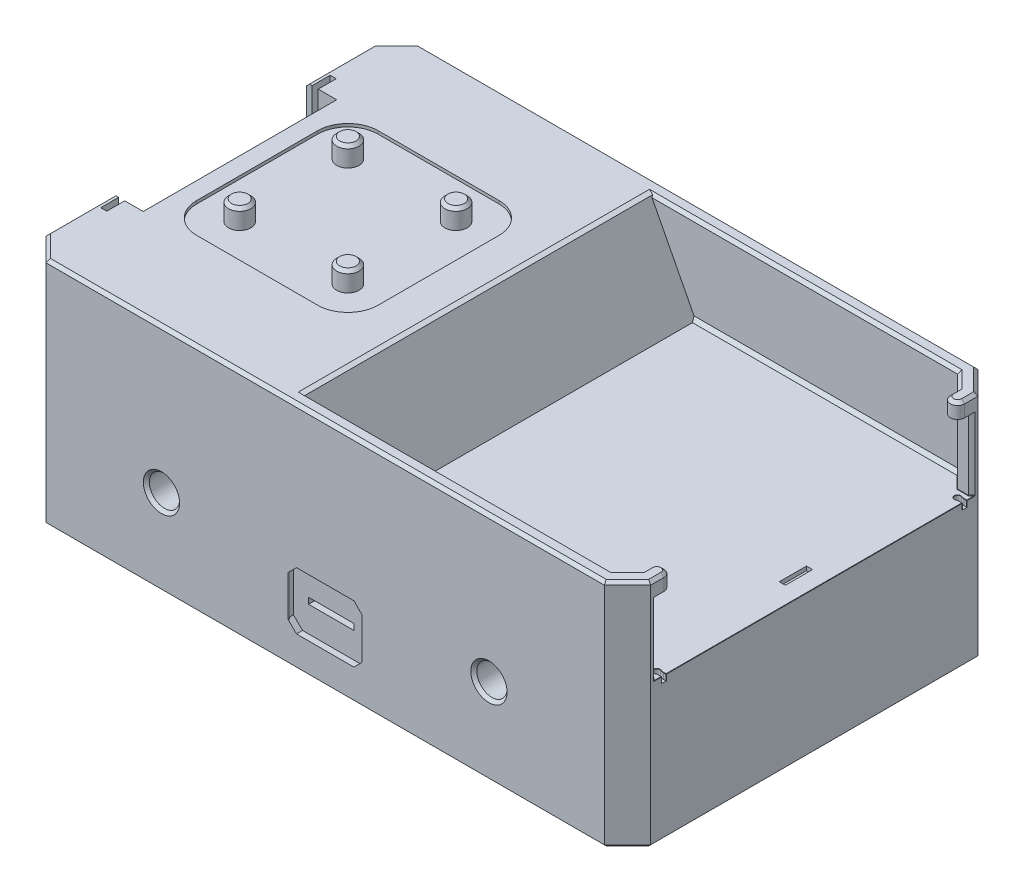
from build123d import *

# Parameters (mm, degrees)
EXTRUDE_1_DEPTH           = 76.3848
CUT_EXTRUDE_3_DEPTH       = 71.3848
CUT_EXTRUDE_4_DEPTH       = 20.3848
CUT_EXTRUDE_4_DEPTH_BACK  = 135
SKETCH_5_R                = 5
SKETCH_10_W               = 10
SKETCH_10_H               = 32
CUT_EXTRUDE_5_DEPTH       = 30
SKETCH_11_W               = 15
SKETCH_11_H               = 2
CUT_EXTRUDE_6_DEPTH       = 146
CUT_EXTRUDE_7_DEPTH       = 2
SKETCH_18_W               = 229.310359278
SKETCH_18_H               = 77.651202659
CUT_EXTRUDE_9_DEPTH       = 117.5
SKETCH_19_W               = 0.5
SKETCH_19_H               = 15
EXTRUDE_2_DEPTH           = 0.5
SKETCH_20_W               = 0.5
SKETCH_20_H               = 15
EXTRUDE_3_DEPTH           = 0.5
CHAMFER_2_SIZE            = 1
SKETCH_22_W               = 2
SKETCH_22_H               = 75.895289502
CUT_EXTRUDE_10_DEPTH      = 34
EXTRUDE_4_DEPTH           = 31
CUT_EXTRUDE_11_DEPTH      = 29
CUT_EXTRUDE_19_DEPTH      = 114.2
EXTRUDE_6_DEPTH           = 114.6
CHAMFER_19_SIZE           = 1
CHAMFER_20_SIZE           = 2
CUT_EXTRUDE_20_DEPTH      = 114.2
SKETCH_35_W               = 104.2
SKETCH_35_H               = 29
CUT_EXTRUDE_21_DEPTH      = 114.2
CHAMFER_24_SIZE           = 1.312830984
CHAMFER_24_SIZE_2         = 0.562935
CHAMFER_26_SIZE           = 1
CHAMFER_3_SIZE            = 1
SKETCH_36_R               = 2.35
EXTRUDE_8_DEPTH           = 5
CUT_EXTRUDE_22_DEPTH      = 26
CUT_EXTRUDE_22_DEPTH_BACK = 2
SKETCH_37_R               = 1
CHAMFER_12_SIZE           = 1
CUT_EXTRUDE_23_DEPTH      = 2
CHAMFER_28_SIZE           = 0.1
CHAMFER_31_SIZE           = 1.1
CHAMFER_32_SIZE           = 1.1
CHAMFER_33_SIZE           = 0.1
SKETCH_50_W               = 2
SKETCH_50_H               = 9
CUT_EXTRUDE_24_DEPTH      = 1.5
SKETCH_52_W               = 1.344454814
SKETCH_52_H               = 8.419143546
EXTRUDE_9_DEPTH           = 0.5
SKETCH_56_R               = 10
EXTRUDE_10_DEPTH          = 115
SKETCH_57_R               = 5
CUT_EXTRUDE_25_DEPTH      = 135
SKETCH_58_R               = 3.698
EXTRUDE_11_DEPTH          = 5.5
CHAMFER_34_SIZE           = 1
CUT_EXTRUDE_START         = -1
CUT_EXTRUDE_27_DEPTH      = 1


with BuildPart() as part:
    # 草图2 → 凸台-拉伸1 (new body)
    with BuildSketch(Plane(origin=(0, 0, 0), x_dir=(1, 0, 0), z_dir=(0, 1, 0))):
        Polygon((92.36152, 61.8), (100, 54.16152), (100, -54.16152), (92.36152, -61.8), (-92.36152, -61.8), (-100, -54.16152), (-100, 54.16152), (-92.36152, 61.8), align=None)
    extrude(amount=EXTRUDE_1_DEPTH)

    # 草图6 → 切除-拉伸3 (cut)
    with BuildSketch(Plane.XZ):
        Polygon((88.042068976, -56.8), (94.222068976, -50.62), (94.222068976, 50.62), (88.042068976, 56.8), (-88.042068976, 56.8), (-94.222068976, 50.62), (-94.222068976, -50.62), (-88.042068976, -56.8), align=None)
    extrude(amount=-CUT_EXTRUDE_3_DEPTH, mode=Mode.SUBTRACT)

    # 草图5 → 切除-拉伸4 (cut, two sides: drawn at the far end of the back side and taken through both)
    with BuildSketch(Plane.XY.offset(61.8).offset(-CUT_EXTRUDE_4_DEPTH_BACK)):
        with Locations(Location((-54.16912, 28.6443, 0), (0, 0, 180))):
            Circle(SKETCH_5_R)
        with Locations(Location((54.16912, 28.6443, 0), (0, 0, 180))):
            Circle(SKETCH_5_R)
    extrude(amount=CUT_EXTRUDE_4_DEPTH + CUT_EXTRUDE_4_DEPTH_BACK, mode=Mode.SUBTRACT)

    # 草图10 → 切除-拉伸5 (cut)
    with BuildSketch(Plane(origin=(0, 76.3848, 0), x_dir=(1, 0, 0), z_dir=(0, 1, 0))):
        Polygon((-100, -32), (-100, 0), (-100, 32), (-110, 32), (-110, -32), align=None)
        with Locations((-95, -16)):
            Rectangle(SKETCH_10_W, SKETCH_10_H)
        with Locations((-95, 16)):
            Rectangle(SKETCH_10_W, SKETCH_10_H)
    extrude(amount=-CUT_EXTRUDE_5_DEPTH, mode=Mode.SUBTRACT)

    # 草图11 → 切除-拉伸6 (cut)
    with BuildSketch(Plane.XY.offset(61.8)):
        with Locations((0, 20)):
            Rectangle(SKETCH_11_W, SKETCH_11_H)
    extrude(amount=-CUT_EXTRUDE_6_DEPTH, mode=Mode.SUBTRACT)

    # 草图12 → 切除-拉伸7 (cut)
    with BuildSketch(Plane.XY.offset(61.8)):
        Polygon((-9.5, 10.5), (-12.5, 13.5), (-12.5, 26.5), (-9.5, 29.5), (9.5, 29.5), (12.5, 26.5), (12.5, 13.5), (9.5, 10.5), align=None)
    extrude(amount=-CUT_EXTRUDE_7_DEPTH, mode=Mode.SUBTRACT)

    # 草图18 → 切除-拉伸9 (cut)
    with BuildSketch(Plane(origin=(0, 76.3848, 0), x_dir=(1, 0, 0), z_dir=(0, 1, 0))):
        with Locations((-2.928886209, 38.82560133)):
            Rectangle(SKETCH_18_W, SKETCH_18_H)
    extrude(amount=-CUT_EXTRUDE_9_DEPTH, mode=Mode.SUBTRACT)

    # 镜向1: part across plane


with BuildPart() as part_1:
    add(part.part)
    add(part.part.mirror(Plane(origin=(-117.584065848, -41.1152, 0), x_dir=(1, 0, 0), z_dir=(0, 0, 1))))

    # 草图19 → 凸台-拉伸2 (add)
    with BuildSketch(Plane(origin=(0, 0, -61.8), x_dir=(-1, 0, 0), z_dir=(0, 0, -1))):
        with Locations((-12.5, 20)):
            Rectangle(SKETCH_19_W, SKETCH_19_H)
        with Locations((12.498440545, 20)):
            Rectangle(SKETCH_19_W, SKETCH_19_H)
    extrude(amount=-EXTRUDE_2_DEPTH)

    # 草图20 → 凸台-拉伸3 (add)
    with BuildSketch(Plane.XY.offset(61.8)):
        with Locations((-12.498440545, 20.147073053)):
            Rectangle(SKETCH_20_W, SKETCH_20_H)
        with Locations((12.5, 20.147073053)):
            Rectangle(SKETCH_20_W, SKETCH_20_H)
    extrude(amount=-EXTRUDE_3_DEPTH)

    # 倒角2
    chamfer_2_edges = [part_1.edges().sort_by_distance(p)[0] for p in [
        (-96.18076, 0, 57.98076),
        (94.222068976, 0, 0),
        (-94.222068976, 0, 0),
        (-100, 0, 0),
        (0, 0, -56.8),
        (-96.18076, 0, -57.98076),
        (0, 0, -61.8),
        (96.18076, 0, -57.98076),
        (-91.132068976, 0, -53.71),
        (91.132068976, 0, -53.71),
        (-91.132068976, 0, 53.71),
        (0, 0, 56.8),
        (91.132068976, 0, 53.71),
        (100, 0, 0),
        (96.18076, 0, 57.98076),
        (0, 0, 61.8),
    ]]
    chamfer(chamfer_2_edges, length=CHAMFER_2_SIZE)

    # 草图22 → 切除-拉伸10 (cut)
    with BuildSketch(Plane(origin=(0, 76.3848, 0), x_dir=(1, 0, 0), z_dir=(0, 1, 0))):
        with Locations((-97.111034488, 0)):
            Rectangle(SKETCH_22_W, SKETCH_22_H)
    extrude(amount=-CUT_EXTRUDE_10_DEPTH, mode=Mode.SUBTRACT)

    # 草图25 → 凸台-拉伸4 (add)
    with BuildSketch(Plane(origin=(0, 76.3848, 0), x_dir=(1, 0, 0), z_dir=(0, 1, 0))):
        Polygon((0.707106781, 60.8), (91.947306438, 60.8), (99, 53.747306438), (99, -53.747306438), (91.947306438, -60.8), (0.707106781, -60.8), align=None)
    extrude(amount=-EXTRUDE_4_DEPTH)

    # 草图26 → 切除-拉伸11 (cut)
    with BuildSketch(Plane(origin=(0, 76.3848, 0), x_dir=(1, 0, 0), z_dir=(0, 1, 0))):
        Polygon((3.7, 57.1), (90.3, 57.1), (95.3, 52.1), (95.3, -52.1), (90.3, -57.1), (3.7, -57.1), align=None)
    extrude(amount=-CUT_EXTRUDE_11_DEPTH, mode=Mode.SUBTRACT)

    # 草图32 → 切除-拉伸19 (cut)
    with BuildSketch(Plane.XY.offset(-57.1)):
        Polygon((3.7, 76.3848), (-11.3, 76.3848), (3.7, 47.3848), align=None)
    extrude(amount=CUT_EXTRUDE_19_DEPTH, mode=Mode.SUBTRACT)

    # 草图33 → 凸台-拉伸6 (add)
    with BuildSketch(Plane.XY.offset(-57.1)):
        Polygon((3.7, 47.3848), (-11.3, 76.3848), (-15.741088216, 74.087685406), (-0.741088216, 45.087685406), align=None)
    extrude(amount=EXTRUDE_6_DEPTH)

    # 倒角19
    # the kernel refuses this chamfer: 1 mm, written as the material it takes off along each edge
    with BuildSketch(Plane(origin=(0.707106781, 45.3848, 56.8), x_dir=(-0.027495876610586306, 0.9996219169112968, 0), z_dir=(0, 0, -1))) as chamfer_19_piece_1_section:
        Polygon((CHAMFER_19_SIZE * 0.999621916911, CHAMFER_19_SIZE * 0.0274958766106), (-CHAMFER_19_SIZE * 0.0274958766106, CHAMFER_19_SIZE * 0.999621916911), (0, 0), align=None)
    chamfer_19_piece_1 = extrude(amount=113.6, mode=Mode.PRIVATE)
    chamfer_19_piece_1 = split(chamfer_19_piece_1, bisect_by=Plane(origin=(0.924503969, 45.949198604, 0), z_dir=(0.4594229188737669, -0.8882176431559488, 0)), keep=Keep.TOP, mode=Mode.PRIVATE)
    add(chamfer_19_piece_1, mode=Mode.SUBTRACT)

    # 倒角20
    chamfer_20_edges = [part_1.edges().sort_by_distance(p)[0] for p in [
        (-0.741088216, 45.087685406, 0),
    ]]
    chamfer(chamfer_20_edges, length=CHAMFER_20_SIZE)

    # 草图34 → 切除-拉伸20 (cut)
    with BuildSketch(Plane.XY.offset(-56.8)):
        Polygon((-1.659934054, 46.864120692), (0.07163221, 46.31316779), (4.534133906, 44.893280887), (0.600613433, 43.316920551), align=None)
    extrude(amount=CUT_EXTRUDE_20_DEPTH, mode=Mode.SUBTRACT)

    # 草图35 → 切除-拉伸21 (cut)
    with BuildSketch(Plane.ZY.offset(-95.3)):
        with Locations((0, 61.8848)):
            Rectangle(SKETCH_35_W, SKETCH_35_H)
    extrude(amount=-CUT_EXTRUDE_21_DEPTH, mode=Mode.SUBTRACT)

    # 倒角24
    # the kernel refuses this chamfer: 1.312830984, 0.562935 mm, written as the material it takes off along each edge
    with BuildSketch(Plane(origin=(-11.3, 76.3848, -57.1), x_dir=(-0.9999317627098931, 0.011682034235790593, 0), z_dir=(0, 0, 1))) as chamfer_24_piece_1:
        Polygon((CHAMFER_24_SIZE * 0.999931763041, CHAMFER_24_SIZE * 0.0116820342397), (-CHAMFER_24_SIZE_2 * 0.469767758015, CHAMFER_24_SIZE_2 * 0.882790039324), (0, 0), align=None)
    extrude(amount=114.2, mode=Mode.SUBTRACT)

    # 倒角26
    chamfer_26_edges = [part_1.edges().sort_by_distance(p)[0] for p in [
        (59.16912, 28.6443, -61.8),
        (-49.16912, 28.6443, -61.8),
    ]]
    chamfer(chamfer_26_edges, length=CHAMFER_26_SIZE)

    # 倒角3
    chamfer_3_edges = [part_1.edges().sort_by_distance(p)[0] for p in [
        (-49.16912, 28.6443, 61.8),
        (59.16912, 28.6443, 61.8),
    ]]
    chamfer(chamfer_3_edges, length=CHAMFER_3_SIZE)

    # 草图36 → 凸台-拉伸8 (add)
    with BuildSketch(Plane(origin=(0, 76.3848, 0), x_dir=(1, 0, 0), z_dir=(0, 1, 0))):
        with Locations((97.65, -49.75)):
            Circle(SKETCH_36_R)
        with BuildLine():
            ThreePointArc((97.65, -52.1), (95.988299064, -51.411700936), (95.3, -49.75))
            Line((95.3, -49.75), (95.3, -52.1))
            Line((95.3, -52.1), (97.65, -52.1))
        make_face()
        with BuildLine():
            Line((100, -52.1), (100, -49.75))
            ThreePointArc((100, -49.75), (99.311700936, -51.411700936), (97.65, -52.1))
            Line((97.65, -52.1), (100, -52.1))
        make_face()
        with Locations((97.65, 49.75)):
            Circle(SKETCH_36_R)
        with BuildLine():
            Line((97.65, 52.1), (95.3, 52.1))
            Line((95.3, 52.1), (95.3, 49.75))
            ThreePointArc((95.3, 49.75), (95.988299064, 51.411700936), (97.65, 52.1))
        make_face()
        with BuildLine():
            Line((100, 52.1), (97.65, 52.1))
            ThreePointArc((97.65, 52.1), (99.311700936, 51.411700936), (100, 49.75))
            Line((100, 49.75), (100, 52.1))
        make_face()
    extrude(amount=-EXTRUDE_8_DEPTH)

    # 草图37 → 切除-拉伸22 (cut, two sides: drawn at the far end of the back side and taken through both)
    with BuildSketch(Plane.XZ.offset(-71.3848).offset(-CUT_EXTRUDE_22_DEPTH_BACK)):
        with Locations(Location((97.65, -49.75, 0), (0, 0, 90))):
            Circle(SKETCH_37_R)
        with Locations(Location((97.65, 49.75, 0), (0, 0, 90))):
            Circle(SKETCH_37_R)
    extrude(amount=CUT_EXTRUDE_22_DEPTH + CUT_EXTRUDE_22_DEPTH_BACK, mode=Mode.SUBTRACT)

    # 倒角12
    # the kernel refuses this chamfer: 1 mm, written as the material it takes off along each edge
    with BuildSketch(Plane(origin=(94.933202988, 76.3848, -61.8), x_dir=(0, 0.027495876610582105, 0.999621916911297), z_dir=(-1, 0, 0)), Plane(origin=(94.933202988, 76.3848, 61.8), x_dir=(0, -0.9996219169112968, 0.027495876610589196), z_dir=(-1, 0, 0))) as chamfer_12_piece_1:
        Polygon((CHAMFER_12_SIZE * 0.999621916911, -CHAMFER_12_SIZE * 0.0274958766106), (-CHAMFER_12_SIZE * 0.0274958766106, -CHAMFER_12_SIZE * 0.999621916911), (0, 0), align=None)
    extrude(amount=189.866405976, mode=Mode.SUBTRACT)
    with BuildSketch(Plane(origin=(-90.54306552, 76.3848, -63.61845448), x_dir=(0.7068394360706739, 0.027495876610582108, 0.7068394360706732), z_dir=(-0.7071067811865472, 0, 0.7071067811865479)), Plane(origin=(101.81845448, 76.3848, 52.34306552), x_dir=(0.019442520806010433, -0.999621916911297, 0.019442520806010416), z_dir=(-0.7071067811865472, 0, 0.7071067811865479)), Plane(origin=(101.81845448, 76.3848, -52.34306552), x_dir=(-0.7068394360706739, 0.027495876610582108, 0.7068394360706732), z_dir=(-0.7071067811865472, 0, -0.7071067811865479))) as chamfer_12_piece_2:
        Polygon((CHAMFER_12_SIZE * 0.999621916911, -CHAMFER_12_SIZE * 0.0274958766106), (-CHAMFER_12_SIZE * 0.0274958766106, -CHAMFER_12_SIZE * 0.999621916911), (0, 0), align=None)
    extrude(amount=15.945807988, mode=Mode.SUBTRACT)
    with BuildSketch(Plane(origin=(-100, 76.3848, -56.733202988), x_dir=(0.999621916911297, 0.027495876610582292, 0), z_dir=(0, 0, 1))) as chamfer_12_piece_3:
        Polygon((CHAMFER_12_SIZE * 0.999621916911, -CHAMFER_12_SIZE * 0.0274958766106), (-CHAMFER_12_SIZE * 0.0274958766106, -CHAMFER_12_SIZE * 0.999621916911), (0, 0), align=None)
    extrude(amount=27.304885976, mode=Mode.SUBTRACT)
    with BuildSketch(Plane(origin=(92.871682988, 76.3848, 57.1), x_dir=(0, 0.027495876610582105, 0.999621916911297), z_dir=(-1, 0, 0))) as chamfer_12_piece_4_section:
        Polygon((CHAMFER_12_SIZE * 0.999621916911, -CHAMFER_12_SIZE * 0.0274958766106), (-CHAMFER_12_SIZE * 0.0274958766106, -CHAMFER_12_SIZE * 0.999621916911), (0, 0), align=None)
    chamfer_12_piece_4 = extrude(amount=106.743365976, mode=Mode.PRIVATE)
    chamfer_12_piece_4 = split(chamfer_12_piece_4, bisect_by=Plane(origin=(34.78725673, 61.302953909, 57.429620247), z_dir=(0.30320365727720744, 0.9529257800131791, 0)), keep=Keep.TOP, mode=Mode.PRIVATE)
    chamfer_12_piece_4 = split(chamfer_12_piece_4, bisect_by=Plane(origin=(64.725819512, 76.055533328, 82.674180488), z_dir=(-0.7071067811865466, 0, -0.7071067811865486)), keep=Keep.TOP, mode=Mode.PRIVATE)
    chamfer_12_piece_4 = split(chamfer_12_piece_4, bisect_by=Plane(origin=(-0.447266099, 55.402847791, 57.429620247), z_dir=(0.8882176431559488, 0.4594229188737667, 0)), keep=Keep.TOP, mode=Mode.PRIVATE)
    add(chamfer_12_piece_4, mode=Mode.SUBTRACT)
    with BuildSketch(Plane(origin=(92.871682988, 76.3848, 57.1), x_dir=(0, 0.027495876610582105, 0.999621916911297), z_dir=(-1, 0, 0))) as chamfer_12_piece_5_section:
        Polygon((CHAMFER_12_SIZE * 0.999621916911, -CHAMFER_12_SIZE * 0.0274958766106), (-CHAMFER_12_SIZE * 0.0274958766106, -CHAMFER_12_SIZE * 0.999621916911), (0, 0), align=None)
    chamfer_12_piece_5 = extrude(amount=106.743365976, mode=Mode.PRIVATE)
    chamfer_12_piece_5 = split(chamfer_12_piece_5, bisect_by=Plane(origin=(-10.508845679, 75.71535013, 57.197754678), z_dir=(-0.30320365727720744, -0.9529257800131791, 0)), keep=Keep.TOP, mode=Mode.PRIVATE)
    chamfer_12_piece_5 = split(chamfer_12_piece_5, bisect_by=Plane(origin=(-10.824530531, 75.465559027, 57.197754678), z_dir=(0.8882176431559488, 0.4594229188737667, 0)), keep=Keep.TOP, mode=Mode.PRIVATE)
    add(chamfer_12_piece_5, mode=Mode.SUBTRACT)
    with BuildSketch(Plane(origin=(92.871682988, 76.3848, 57.1), x_dir=(0, 0.027495876610582105, 0.999621916911297), z_dir=(-1, 0, 0))) as chamfer_12_piece_6_section:
        Polygon((CHAMFER_12_SIZE * 0.999621916911, -CHAMFER_12_SIZE * 0.0274958766106), (-CHAMFER_12_SIZE * 0.0274958766106, -CHAMFER_12_SIZE * 0.999621916911), (0, 0), align=None)
    chamfer_12_piece_6 = extrude(amount=106.743365976, mode=Mode.PRIVATE)
    chamfer_12_piece_6 = split(chamfer_12_piece_6, bisect_by=Plane(origin=(-11.758522746, 76.112974651, 57.536386216), z_dir=(0.30320365727720744, 0.9529257800131791, 0)), keep=Keep.TOP, mode=Mode.PRIVATE)
    chamfer_12_piece_6 = split(chamfer_12_piece_6, bisect_by=Plane(origin=(-11.333395246, 76.449364142, 57.536386216), z_dir=(-0.8882176431559488, -0.4594229188737667, 0)), keep=Keep.TOP, mode=Mode.PRIVATE)
    add(chamfer_12_piece_6, mode=Mode.SUBTRACT)
    with BuildSketch(Plane(origin=(97.11845448, 76.3848, 50.28154552), x_dir=(0.7068394360706726, 0.027495876610582108, 0.7068394360706746), z_dir=(-0.7071067811865486, 0, 0.7071067811865466))) as chamfer_12_piece_7_section:
        Polygon((CHAMFER_12_SIZE * 0.999621916911, -CHAMFER_12_SIZE * 0.0274958766106), (-CHAMFER_12_SIZE * 0.0274958766106, -CHAMFER_12_SIZE * 0.999621916911), (0, 0), align=None)
    chamfer_12_piece_7 = extrude(amount=12.214433788, mode=Mode.PRIVATE)
    chamfer_12_piece_7 = split(chamfer_12_piece_7, bisect_by=Plane(origin=(93.019192224, 76.044416391, 57.1), z_dir=(0, 0, -1)), keep=Keep.TOP, mode=Mode.PRIVATE)
    chamfer_12_piece_7 = split(chamfer_12_piece_7, bisect_by=Plane(origin=(95.3, 76.044416391, 54.819192224), z_dir=(-1, 0, 0)), keep=Keep.TOP, mode=Mode.PRIVATE)
    add(chamfer_12_piece_7, mode=Mode.SUBTRACT)
    with BuildSketch(Plane(origin=(100, 76.3848, 56.733202988), x_dir=(-0.999621916911297, 0.027495876610582292, -3.2200878226457506e-15), z_dir=(0, 0, -1)), Plane(origin=(100, 76.3848, -49.75), x_dir=(-0.999621916911297, 0.027495876610582292, 3.2200878226457506e-15), z_dir=(0, 0, -1))) as chamfer_12_piece_8:
        Polygon((CHAMFER_12_SIZE * 0.999621916911, -CHAMFER_12_SIZE * 0.0274958766106), (-CHAMFER_12_SIZE * 0.0274958766106, -CHAMFER_12_SIZE * 0.999621916911), (0, 0), align=None)
    extrude(amount=6.983202988, mode=Mode.SUBTRACT)
    with BuildSketch(Plane(origin=(-100, 76.3848, 56.733202988), x_dir=(0.999621916911297, 0.027495876610582292, 0), z_dir=(0, 0, -1))) as chamfer_12_piece_9:
        Polygon((CHAMFER_12_SIZE * 0.999621916911, CHAMFER_12_SIZE * 0.0274958766106), (-CHAMFER_12_SIZE * 0.0274958766106, CHAMFER_12_SIZE * 0.999621916911), (0, 0), align=None)
    extrude(amount=27.304885976, mode=Mode.SUBTRACT)
    with BuildSketch(Plane(origin=(-90.54306552, 76.3848, 63.61845448), x_dir=(0.7068394360706739, 0.027495876610582108, -0.7068394360706732), z_dir=(-0.7071067811865472, 0, -0.7071067811865479))) as chamfer_12_piece_10:
        Polygon((CHAMFER_12_SIZE * 0.999621916911, CHAMFER_12_SIZE * 0.0274958766106), (-CHAMFER_12_SIZE * 0.0274958766106, CHAMFER_12_SIZE * 0.999621916911), (0, 0), align=None)
    extrude(amount=15.945807988, mode=Mode.SUBTRACT)
    with BuildSketch(Plane(origin=(-15.184513972, 76.3848, -57.1), x_dir=(0, 0.027495876610582105, -0.999621916911297), z_dir=(1, 0, 0))) as chamfer_12_piece_11_section:
        Polygon((CHAMFER_12_SIZE * 0.999621916911, -CHAMFER_12_SIZE * 0.0274958766106), (-CHAMFER_12_SIZE * 0.0274958766106, -CHAMFER_12_SIZE * 0.999621916911), (0, 0), align=None)
    chamfer_12_piece_11 = extrude(amount=108.05619696, mode=Mode.PRIVATE)
    chamfer_12_piece_11 = split(chamfer_12_piece_11, bisect_by=Plane(origin=(-10.508845679, 75.71535013, -57.197754678), z_dir=(-0.30320365727720744, -0.9529257800131791, 0)), keep=Keep.TOP, mode=Mode.PRIVATE)
    chamfer_12_piece_11 = split(chamfer_12_piece_11, bisect_by=Plane(origin=(-10.824530531, 75.465559027, -57.197754678), z_dir=(0.8882176431559488, 0.4594229188737667, 0)), keep=Keep.TOP, mode=Mode.PRIVATE)
    add(chamfer_12_piece_11, mode=Mode.SUBTRACT)
    with BuildSketch(Plane(origin=(-15.184513972, 76.3848, -57.1), x_dir=(0, 0.027495876610582105, -0.999621916911297), z_dir=(1, 0, 0))) as chamfer_12_piece_12_section:
        Polygon((CHAMFER_12_SIZE * 0.999621916911, -CHAMFER_12_SIZE * 0.0274958766106), (-CHAMFER_12_SIZE * 0.0274958766106, -CHAMFER_12_SIZE * 0.999621916911), (0, 0), align=None)
    chamfer_12_piece_12 = extrude(amount=108.05619696, mode=Mode.PRIVATE)
    chamfer_12_piece_12 = split(chamfer_12_piece_12, bisect_by=Plane(origin=(-11.758522746, 76.112974651, -57.536386216), z_dir=(0.30320365727720744, 0.9529257800131791, 0)), keep=Keep.TOP, mode=Mode.PRIVATE)
    chamfer_12_piece_12 = split(chamfer_12_piece_12, bisect_by=Plane(origin=(-11.333395246, 76.449364142, -57.536386216), z_dir=(-0.8882176431559488, -0.4594229188737667, 0)), keep=Keep.TOP, mode=Mode.PRIVATE)
    add(chamfer_12_piece_12, mode=Mode.SUBTRACT)
    with BuildSketch(Plane(origin=(-15.184513972, 76.3848, -57.1), x_dir=(0, 0.027495876610582105, -0.999621916911297), z_dir=(1, 0, 0))) as chamfer_12_piece_13_section:
        Polygon((CHAMFER_12_SIZE * 0.999621916911, -CHAMFER_12_SIZE * 0.0274958766106), (-CHAMFER_12_SIZE * 0.0274958766106, -CHAMFER_12_SIZE * 0.999621916911), (0, 0), align=None)
    chamfer_12_piece_13 = extrude(amount=108.05619696, mode=Mode.PRIVATE)
    chamfer_12_piece_13 = split(chamfer_12_piece_13, bisect_by=Plane(origin=(64.725819512, 76.055533328, -82.674180488), z_dir=(-0.7071067811865466, 0, 0.7071067811865486)), keep=Keep.TOP, mode=Mode.PRIVATE)
    chamfer_12_piece_13 = split(chamfer_12_piece_13, bisect_by=Plane(origin=(34.78725673, 61.302953909, -57.429620247), z_dir=(0.30320365727720744, 0.9529257800131791, 0)), keep=Keep.TOP, mode=Mode.PRIVATE)
    chamfer_12_piece_13 = split(chamfer_12_piece_13, bisect_by=Plane(origin=(-0.447266099, 55.402847791, -57.429620247), z_dir=(0.8882176431559488, 0.4594229188737667, 0)), keep=Keep.TOP, mode=Mode.PRIVATE)
    add(chamfer_12_piece_13, mode=Mode.SUBTRACT)
    with BuildSketch(Plane(origin=(88.48154552, 76.3848, -58.91845448), x_dir=(0.7068394360706726, 0.027495876610582108, -0.7068394360706746), z_dir=(0.7071067811865486, 0, 0.7071067811865466))) as chamfer_12_piece_14_section:
        Polygon((CHAMFER_12_SIZE * 0.999621916911, -CHAMFER_12_SIZE * 0.0274958766106), (-CHAMFER_12_SIZE * 0.0274958766106, -CHAMFER_12_SIZE * 0.999621916911), (0, 0), align=None)
    chamfer_12_piece_14 = extrude(amount=12.214433788, mode=Mode.PRIVATE)
    chamfer_12_piece_14 = split(chamfer_12_piece_14, bisect_by=Plane(origin=(95.3, 76.044416391, -54.819192224), z_dir=(-1, 0, 0)), keep=Keep.TOP, mode=Mode.PRIVATE)
    chamfer_12_piece_14 = split(chamfer_12_piece_14, bisect_by=Plane(origin=(93.019192224, 76.044416391, -57.1), z_dir=(0, 0, 1)), keep=Keep.TOP, mode=Mode.PRIVATE)
    add(chamfer_12_piece_14, mode=Mode.SUBTRACT)
    with BuildSketch(Plane(origin=(95.3, 76.3848, 49.75), x_dir=(0.999621916911297, 0.027495876610582292, 0), z_dir=(0, 0, 1))) as chamfer_12_piece_15_section:
        Polygon((CHAMFER_12_SIZE * 0.999621916911, -CHAMFER_12_SIZE * 0.0274958766106), (-CHAMFER_12_SIZE * 0.0274958766106, -CHAMFER_12_SIZE * 0.999621916911), (0, 0), align=None)
    chamfer_12_piece_15 = extrude(amount=4.921682988, mode=Mode.PRIVATE)
    chamfer_12_piece_15 = split(chamfer_12_piece_15, bisect_by=Plane(origin=(96.111269952, 76.038201787, 51.288730048), z_dir=(-0.7071067811865466, 0, -0.7071067811865486)), keep=Keep.TOP, mode=Mode.PRIVATE)
    add(chamfer_12_piece_15, mode=Mode.SUBTRACT)
    with BuildSketch(Plane(origin=(97.65, 76.3848, 49.75), x_dir=(-1, 0, 0), z_dir=(0, 0, 1))) as chamfer_12_piece_16:
        Polygon((2.35 - CHAMFER_12_SIZE, 0), (2.35, CHAMFER_12_SIZE), (2.35, 0), align=None)
    revolve(axis=Axis((97.65, 76.3848, 49.75), (0, -1, 0)), revolution_arc=180, mode=Mode.SUBTRACT)
    with BuildSketch(Plane(origin=(95.3, 76.3848, -54.671682988), x_dir=(0.999621916911297, 0.027495876610582292, 0), z_dir=(0, 0, 1))) as chamfer_12_piece_17_section:
        Polygon((CHAMFER_12_SIZE * 0.999621916911, -CHAMFER_12_SIZE * 0.0274958766106), (-CHAMFER_12_SIZE * 0.0274958766106, -CHAMFER_12_SIZE * 0.999621916911), (0, 0), align=None)
    chamfer_12_piece_17 = extrude(amount=4.921682988, mode=Mode.PRIVATE)
    chamfer_12_piece_17 = split(chamfer_12_piece_17, bisect_by=Plane(origin=(96.111269952, 76.038201787, -51.288730048), z_dir=(-0.7071067811865466, 0, 0.7071067811865486)), keep=Keep.TOP, mode=Mode.PRIVATE)
    add(chamfer_12_piece_17, mode=Mode.SUBTRACT)
    with BuildSketch(Plane(origin=(97.65, 76.3848, -49.75), x_dir=(1, 0, 0), z_dir=(0, 0, -1))) as chamfer_12_piece_18:
        Polygon((2.35 - CHAMFER_12_SIZE, 0), (2.35, CHAMFER_12_SIZE), (2.35, 0), align=None)
    revolve(axis=Axis((97.65, 76.3848, -49.75), (0, -1, 0)), revolution_arc=180, mode=Mode.SUBTRACT)
    with BuildSketch(Plane(origin=(92.871682988, 76.3848, 57.1), x_dir=(0, 0.027495876610582105, 0.999621916911297), z_dir=(-1, 0, 0))) as chamfer_12_piece_19a_section:
        Polygon((CHAMFER_12_SIZE * 0.999621916911, -CHAMFER_12_SIZE * 0.0274958766106), (-CHAMFER_12_SIZE * 0.0274958766106, -CHAMFER_12_SIZE * 0.999621916911), (0, 0), align=None)
    chamfer_12_piece_19a = extrude(amount=106.743365976, mode=Mode.PRIVATE)
    chamfer_12_piece_19a = split(chamfer_12_piece_19a, bisect_by=Plane(origin=(90.679160813, 76.066706875, 56.720839187), z_dir=(0.7071067811865466, 0, 0.7071067811865486)), keep=Keep.TOP, mode=Mode.PRIVATE)
    with BuildSketch(Plane(origin=(97.11845448, 76.3848, 50.28154552), x_dir=(0.7068394360706726, 0.027495876610582108, 0.7068394360706746), z_dir=(-0.7071067811865486, 0, 0.7071067811865466))) as chamfer_12_piece_19b_section:
        Polygon((CHAMFER_12_SIZE * 0.999621916911, -CHAMFER_12_SIZE * 0.0274958766106), (-CHAMFER_12_SIZE * 0.0274958766106, -CHAMFER_12_SIZE * 0.999621916911), (0, 0), align=None)
    chamfer_12_piece_19b = extrude(amount=12.214433788, mode=Mode.PRIVATE)
    chamfer_12_piece_19b = split(chamfer_12_piece_19b, bisect_by=Plane(origin=(89.763785635, 76.066706875, 57.1), z_dir=(0, 0, 1)), keep=Keep.TOP, mode=Mode.PRIVATE)
    chamfer_12_piece_19 = chamfer_12_piece_19a & chamfer_12_piece_19b
    add(chamfer_12_piece_19, mode=Mode.SUBTRACT)
    with BuildSketch(Plane(origin=(97.11845448, 76.3848, 50.28154552), x_dir=(0.7068394360706726, 0.027495876610582108, 0.7068394360706746), z_dir=(-0.7071067811865486, 0, 0.7071067811865466))) as chamfer_12_piece_20a_section:
        Polygon((CHAMFER_12_SIZE * 0.999621916911, -CHAMFER_12_SIZE * 0.0274958766106), (-CHAMFER_12_SIZE * 0.0274958766106, -CHAMFER_12_SIZE * 0.999621916911), (0, 0), align=None)
    chamfer_12_piece_20a = extrude(amount=12.214433788, mode=Mode.PRIVATE)
    chamfer_12_piece_20a = split(chamfer_12_piece_20a, bisect_by=Plane(origin=(95.3, 76.066706875, 51.563785635), z_dir=(1, 0, 0)), keep=Keep.TOP, mode=Mode.PRIVATE)
    with BuildSketch(Plane(origin=(95.3, 76.3848, 49.75), x_dir=(0.999621916911297, 0.027495876610582292, 0), z_dir=(0, 0, 1))) as chamfer_12_piece_20b_section:
        Polygon((CHAMFER_12_SIZE * 0.999621916911, -CHAMFER_12_SIZE * 0.0274958766106), (-CHAMFER_12_SIZE * 0.0274958766106, -CHAMFER_12_SIZE * 0.999621916911), (0, 0), align=None)
    chamfer_12_piece_20b = extrude(amount=4.921682988, mode=Mode.PRIVATE)
    chamfer_12_piece_20b = split(chamfer_12_piece_20b, bisect_by=Plane(origin=(94.920839187, 76.066706875, 52.479160813), z_dir=(0.7071067811865466, 0, 0.7071067811865486)), keep=Keep.TOP, mode=Mode.PRIVATE)
    chamfer_12_piece_20 = chamfer_12_piece_20a & chamfer_12_piece_20b
    add(chamfer_12_piece_20, mode=Mode.SUBTRACT)
    with BuildSketch(Plane(origin=(88.48154552, 76.3848, -58.91845448), x_dir=(0.7068394360706726, 0.027495876610582108, -0.7068394360706746), z_dir=(0.7071067811865486, 0, 0.7071067811865466))) as chamfer_12_piece_21a_section:
        Polygon((CHAMFER_12_SIZE * 0.999621916911, -CHAMFER_12_SIZE * 0.0274958766106), (-CHAMFER_12_SIZE * 0.0274958766106, -CHAMFER_12_SIZE * 0.999621916911), (0, 0), align=None)
    chamfer_12_piece_21a = extrude(amount=12.214433788, mode=Mode.PRIVATE)
    chamfer_12_piece_21a = split(chamfer_12_piece_21a, bisect_by=Plane(origin=(89.763785635, 76.066706875, -57.1), z_dir=(0, 0, -1)), keep=Keep.TOP, mode=Mode.PRIVATE)
    with BuildSketch(Plane(origin=(-15.184513972, 76.3848, -57.1), x_dir=(0, 0.027495876610582105, -0.999621916911297), z_dir=(1, 0, 0))) as chamfer_12_piece_21b_section:
        Polygon((CHAMFER_12_SIZE * 0.999621916911, -CHAMFER_12_SIZE * 0.0274958766106), (-CHAMFER_12_SIZE * 0.0274958766106, -CHAMFER_12_SIZE * 0.999621916911), (0, 0), align=None)
    chamfer_12_piece_21b = extrude(amount=108.05619696, mode=Mode.PRIVATE)
    chamfer_12_piece_21b = split(chamfer_12_piece_21b, bisect_by=Plane(origin=(90.679160813, 76.066706875, -56.720839187), z_dir=(0.7071067811865466, 0, -0.7071067811865486)), keep=Keep.TOP, mode=Mode.PRIVATE)
    chamfer_12_piece_21 = chamfer_12_piece_21a & chamfer_12_piece_21b
    add(chamfer_12_piece_21, mode=Mode.SUBTRACT)
    with BuildSketch(Plane(origin=(95.3, 76.3848, -54.671682988), x_dir=(0.999621916911297, 0.027495876610582292, 0), z_dir=(0, 0, 1))) as chamfer_12_piece_22a_section:
        Polygon((CHAMFER_12_SIZE * 0.999621916911, -CHAMFER_12_SIZE * 0.0274958766106), (-CHAMFER_12_SIZE * 0.0274958766106, -CHAMFER_12_SIZE * 0.999621916911), (0, 0), align=None)
    chamfer_12_piece_22a = extrude(amount=4.921682988, mode=Mode.PRIVATE)
    chamfer_12_piece_22a = split(chamfer_12_piece_22a, bisect_by=Plane(origin=(94.920839187, 76.066706875, -52.479160813), z_dir=(0.7071067811865466, 0, -0.7071067811865486)), keep=Keep.TOP, mode=Mode.PRIVATE)
    with BuildSketch(Plane(origin=(88.48154552, 76.3848, -58.91845448), x_dir=(0.7068394360706726, 0.027495876610582108, -0.7068394360706746), z_dir=(0.7071067811865486, 0, 0.7071067811865466))) as chamfer_12_piece_22b_section:
        Polygon((CHAMFER_12_SIZE * 0.999621916911, -CHAMFER_12_SIZE * 0.0274958766106), (-CHAMFER_12_SIZE * 0.0274958766106, -CHAMFER_12_SIZE * 0.999621916911), (0, 0), align=None)
    chamfer_12_piece_22b = extrude(amount=12.214433788, mode=Mode.PRIVATE)
    chamfer_12_piece_22b = split(chamfer_12_piece_22b, bisect_by=Plane(origin=(95.3, 76.066706875, -51.563785635), z_dir=(1, 0, 0)), keep=Keep.TOP, mode=Mode.PRIVATE)
    chamfer_12_piece_22 = chamfer_12_piece_22a & chamfer_12_piece_22b
    add(chamfer_12_piece_22, mode=Mode.SUBTRACT)

    # 草图40 → 切除-拉伸23 (cut)
    with BuildSketch(Plane(origin=(0, 47.3848, 0), x_dir=(1, 0, 0), z_dir=(0, 1, 0))):
        with BuildLine():
            Line((99.089110937, 49.017847845), (99.9, 49.017847845))
            ThreePointArc((99.9, 49.017847845), (99.970710678, 48.988558523), (100, 48.917847845))
            Line((100, 48.917847845), (100, 48.655362479))
            Line((100, 48.655362479), (100.496560866, 48.655362479))
            Line((100.496560866, 48.655362479), (100.496560866, 50.821149093))
            Line((100.496560866, 50.821149093), (100, 50.821149093))
            Line((100, 50.821149093), (100, 50.566891041))
            ThreePointArc((100, 50.566891041), (99.970710678, 50.496180363), (99.9, 50.466891041))
            Line((99.9, 50.466891041), (99.128080171, 50.466891041))
            ThreePointArc((99.128080171, 50.466891041), (98.563724273, 50.520452102), (98.019520043, 50.67922276))
            ThreePointArc((98.019520043, 50.67922276), (96.650013684, 49.75523137), (98.009777734, 48.816961961))
            ThreePointArc((98.009777734, 48.816961961), (98.540176674, 48.96719882), (99.089110937, 49.017847845))
        make_face()
        with BuildLine():
            Line((100, -48.678850907), (100, -48.933108959))
            ThreePointArc((100, -48.933108959), (99.970710678, -49.003819637), (99.9, -49.033108959))
            Line((99.9, -49.033108959), (99.128080171, -49.033108959))
            ThreePointArc((99.128080171, -49.033108959), (98.563724273, -48.979547898), (98.019520043, -48.82077724))
            ThreePointArc((98.019520043, -48.82077724), (96.650013684, -49.74476863), (98.009777734, -50.683038039))
            ThreePointArc((98.009777734, -50.683038039), (98.540176674, -50.53280118), (99.089110937, -50.482152155))
            Line((99.089110937, -50.482152155), (99.9, -50.482152155))
            ThreePointArc((99.9, -50.482152155), (99.970710678, -50.511441477), (100, -50.582152155))
            Line((100, -50.582152155), (100, -50.844637521))
            Line((100, -50.844637521), (100.496560866, -50.844637521))
            Line((100.496560866, -50.844637521), (100.496560866, -48.678850907))
            Line((100.496560866, -48.678850907), (100, -48.678850907))
        make_face()
    extrude(amount=-CUT_EXTRUDE_23_DEPTH, mode=Mode.SUBTRACT)

    # 倒角28
    chamfer_28_edges = [part_1.edges().sort_by_distance(p)[0] for p in [
        (100, 47.3848, -51.33344552),
        (96.650013684, 47.3848, -49.75523137),
        (96.650013684, 47.3848, 49.74476863),
        (100, 47.3848, 0.007630557),
        (100, 47.3848, 51.341076078),
        (99.970710678, 47.3848, -48.988558523),
        (99.970710678, 47.3848, -50.496180363),
        (99.514040085, 47.3848, -50.466891041),
        (98.563724273, 47.3848, -50.520452102),
        (98.540176674, 47.3848, -48.96719882),
        (99.494555469, 47.3848, -49.017847845),
        (99.970710678, 47.3848, 50.511441477),
        (99.970710678, 47.3848, 49.003819637),
        (99.514040085, 47.3848, 49.033108959),
        (98.563724273, 47.3848, 48.979547898),
        (98.540176674, 47.3848, 50.53280118),
        (99.494555469, 47.3848, 50.482152155),
    ]]
    chamfer(chamfer_28_edges, length=CHAMFER_28_SIZE)

    # 倒角31
    chamfer_31_edges = [part_1.edges().sort_by_distance(p)[0] for p in [
        (100, 59.3348, 52.1),
        (100, 59.3348, -52.1),
    ]]
    chamfer(chamfer_31_edges, length=CHAMFER_31_SIZE)

    # 倒角32
    chamfer_32_edges = [part_1.edges().sort_by_distance(p)[0] for p in [
        (47, 47.3848, 57.1),
        (47, 47.3848, -57.1),
    ]]
    chamfer(chamfer_32_edges, length=CHAMFER_32_SIZE)

    # 倒角33
    chamfer_33_edges = [part_1.edges().sort_by_distance(p)[0] for p in [
        (93.35, 47.3848, 54.05),
        (97.1, 47.3848, 52.1),
        (97.1, 47.3848, -52.1),
        (99.4, 47.3848, 52.6),
        (99.4, 47.3848, -52.6),
        (93.35, 47.3848, -54.05),
    ]]
    chamfer(chamfer_33_edges, length=CHAMFER_33_SIZE)

    # 草图50 → 切除-拉伸24 (cut)
    with BuildSketch(Plane(origin=(0, 47.3848, 0), x_dir=(1, 0, 0), z_dir=(0, 1, 0))):
        with Locations((93.3, 0.623346637)):
            Rectangle(SKETCH_50_W, SKETCH_50_H)
    extrude(amount=-CUT_EXTRUDE_24_DEPTH, mode=Mode.SUBTRACT)

    # 草图52 → 凸台-拉伸9 (add)
    with BuildSketch(Plane(origin=(0, 45.8848, 0), x_dir=(1, 0, 0), z_dir=(0, 1, 0))):
        with Locations((93.3, 0.623346637)):
            Rectangle(SKETCH_52_W, SKETCH_52_H)
    extrude(amount=EXTRUDE_9_DEPTH)

    # 草图56 → 凸台-拉伸10 (add)
    with BuildSketch(Plane.XY.offset(-56.8)):
        with Locations(Location((-54.16912, 28.6443, 0), (0, 0, 180))):
            Circle(SKETCH_56_R)
        with Locations(Location((54.16912, 28.6443, 0), (0, 0, 180))):
            Circle(SKETCH_56_R)
    extrude(amount=EXTRUDE_10_DEPTH)

    # 草图57 → 切除-拉伸25 (cut)
    with BuildSketch(Plane.XY.offset(61.8)):
        with Locations((-54.16912, 28.6443)):
            Circle(SKETCH_57_R)
        with Locations((54.16912, 28.6443)):
            Circle(SKETCH_57_R)
    extrude(amount=-CUT_EXTRUDE_25_DEPTH, mode=Mode.SUBTRACT)

    # 草图58 → 凸台-拉伸11 (add)
    with BuildSketch(Plane(origin=(0, 76.3848, 0), x_dir=(1, 0, 0), z_dir=(0, 1, 0))):
        with Locations(Location((-72.187549237, 17.896, 0), (0, 0, 270))):
            Circle(SKETCH_58_R)
        with Locations(Location((-36.395549237, 17.896, 0), (0, 0, 270))):
            Circle(SKETCH_58_R)
        with Locations(Location((-72.187549237, -17.896, 0), (0, 0, 270))):
            Circle(SKETCH_58_R)
        with Locations(Location((-36.395549237, -17.896, 0), (0, 0, 270))):
            Circle(SKETCH_58_R)
    extrude(amount=EXTRUDE_11_DEPTH)

    # 倒角34
    chamfer_34_edges = [part_1.edges().sort_by_distance(p)[0] for p in [
        (-36.395549237, 81.8848, 14.198),
        (-72.187549237, 81.8848, -21.594),
        (-36.395549237, 81.8848, -21.594),
        (-72.187549237, 81.8848, 14.198),
    ]]
    chamfer(chamfer_34_edges, length=CHAMFER_34_SIZE)

    # 草图59 → 切除-拉伸27 (cut)
    # profile 1 of 2: a face of its own
    with BuildSketch(Plane(origin=(0, 76.3848, 0), x_dir=(1, 0, 0), z_dir=(0, 1, 0)).offset(CUT_EXTRUDE_START)):
        with BuildLine():
            Line((-74.291549237, -30), (-34.291549237, -30))
            ThreePointArc((-34.291549237, -30), (-27.220481425, -27.071067812), (-24.291549237, -20))
            Line((-24.291549237, -20), (-24.291549237, 20))
            ThreePointArc((-24.291549237, 20), (-27.220481425, 27.071067812), (-34.291549237, 30))
            Line((-34.291549237, 30), (-74.291549237, 30))
            ThreePointArc((-74.291549237, 30), (-81.362617049, 27.071067812), (-84.291549237, 20))
            Line((-84.291549237, 20), (-84.291549237, -20))
            ThreePointArc((-84.291549237, -20), (-81.362617049, -27.071067812), (-74.291549237, -30))
        make_face()
        with BuildLine():
            ThreePointArc((-68.489549237, -17.896), (-75.604055748, -19.311163333), (-69.57266836, -15.281119123))
            ThreePointArc((-69.57266836, -15.281119123), (-68.771042726, -16.480836667), (-68.489549237, -17.896))
        make_face(mode=Mode.SUBTRACT)
        with BuildLine():
            ThreePointArc((-68.489549237, 17.896), (-68.771042726, 16.480836667), (-69.57266836, 15.281119123))
            ThreePointArc((-69.57266836, 15.281119123), (-75.604055748, 19.311163333), (-68.489549237, 17.896))
        make_face(mode=Mode.SUBTRACT)
        with BuildLine():
            Line((-39.010430114, -15.281119123), (-54.291549237, 0))
            Line((-54.291549237, 0), (-39.010430114, 15.281119123))
            ThreePointArc((-39.010430114, 15.281119123), (-37.81071257, 21.312506511), (-32.697549237, 17.896))
            ThreePointArc((-32.697549237, 17.896), (-33.78066836, 15.281119123), (-36.395549237, 14.198))
            Line((-36.395549237, 14.198), (-36.395549237, -14.198))
            ThreePointArc((-36.395549237, -14.198), (-33.78066836, -15.281119123), (-32.697549237, -17.896))
            ThreePointArc((-32.697549237, -17.896), (-37.81071257, -21.312506511), (-39.010430114, -15.281119123))
        make_face(mode=Mode.SUBTRACT)
    # profile 2 of 2: a face of its own
    with BuildSketch(Plane(origin=(0, 76.3848, 0), x_dir=(1, 0, 0), z_dir=(0, 1, 0)).offset(CUT_EXTRUDE_START)):
        with BuildLine():
            Line((-39.010430114, 15.281119123), (-54.291549237, 0))
            Line((-54.291549237, 0), (-39.010430114, -15.281119123))
            ThreePointArc((-39.010430114, -15.281119123), (-37.81071257, -14.479493489), (-36.395549237, -14.198))
            Line((-36.395549237, -14.198), (-36.395549237, 14.198))
            ThreePointArc((-36.395549237, 14.198), (-37.81071257, 14.479493489), (-39.010430114, 15.281119123))
        make_face()
    extrude(amount=CUT_EXTRUDE_27_DEPTH, mode=Mode.SUBTRACT)


solid = part_1.part
